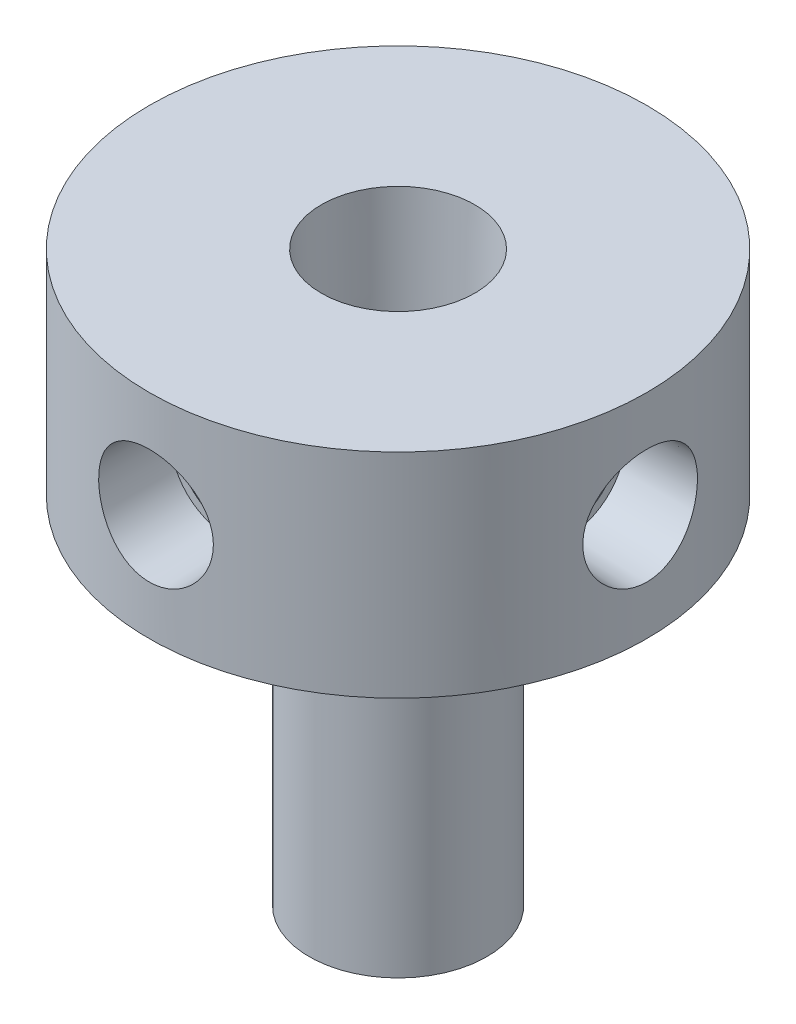
from build123d import *

# Parameters (mm, degrees)
SKETCH1_R                              = 22.225
BOSS_EXTRUDE1_DEPTH                    = 50.8
SKETCH2_OUTSIDE_W                      = 62.614
SKETCH2_OUTSIDE_H                      = 62.614
SKETCH2_OUTSIDE_R                      = 7.9375
CUT_EXTRUDE1_DEPTH                     = 31.75
F_1_8_0_125_DIAMETER_HOLE1_D           = 3.175
F_1_8_START                            = -22.225000076
F_1_8_0_125_DIAMETER_HOLE2_OUTLINE_R   = 1.5875
F_1_8_0_125_DIAMETER_HOLE2_DEPTH       = 31.186397695
F_1_8_START_2                          = -8.961397619
F_1_8_0_125_DIAMETER_HOLE2_2_OUTLINE_R = 1.5875
F_1_8_0_125_DIAMETER_HOLE2_2_DEPTH     = 17.922795238
F_1_8_27_NPSM_TAPPED_HOLE1_D           = 9.0932
F_1_8_27_NPSM_TAPPED_HOLE1_DEPTH       = 6.35
F_1_8_27_NPSM_TAPPED_HOLE1_TIP         = 2.73187289
CUT_EXTRUDE2_START                     = -13.97
SKETCH11_R                             = 4.5466
CUT_EXTRUDE2_DEPTH                     = 6.35
SKETCH12_R                             = 2.54
CUT_EXTRUDE3_DEPTH                     = 1.5875
CUT_EXTRUDE5_START                     = -31.75
SKETCH13_OUTSIDE_W                     = 62.614
SKETCH13_OUTSIDE_H                     = 62.614
SKETCH13_OUTSIDE_R                     = 6.35
CUT_EXTRUDE5_DEPTH                     = 1.5875


# Read off the part's stored shape, not the designer's step: 1/8 (0.125) Diameter Hole2
with BuildPart() as part:
    # Sketch1 → Boss-Extrude1 (new body)
    with BuildSketch(Plane(origin=(0, 0, 0), x_dir=(1, 0, 0), z_dir=(0, 1, 0))):
        with Locations(Location((0, 0, 0), (0, 0, 270))):
            Circle(SKETCH1_R)
    extrude(amount=BOSS_EXTRUDE1_DEPTH)

    # Sketch2 outside → Cut-Extrude1 (cut)
    with BuildSketch(Plane(origin=(0, 0, 0), x_dir=(-1, 0, 0), z_dir=(0, -1, 0))):
        Rectangle(SKETCH2_OUTSIDE_W, SKETCH2_OUTSIDE_H)
        with Locations(Location((0, 0, 0), (0, 0, 90))):
            Circle(SKETCH2_OUTSIDE_R, mode=Mode.SUBTRACT)
    extrude(amount=-CUT_EXTRUDE1_DEPTH, mode=Mode.SUBTRACT)

    # 1/8 (0.125) Diameter Hole1 (through all)
    with Locations(Plane(origin=(0, 50.8, 0), x_dir=(1, 0, 0), z_dir=(0, 1, 0))):
        with Locations((0, 0)):
            Hole(F_1_8_0_125_DIAMETER_HOLE1_D / 2)

    # Sketch6 → 1/4 NPT Tapped Hole1 (revolve, cut)
    with BuildSketch(Plane(origin=(0, 50.8, 0), x_dir=(0, 0, 1), z_dir=(1, 0, 0))):
        Polygon((0, 0), (0, 20.275689079), (5.5626, 16.9333418), (5.5626, 9.906), (6.557984794, 9.906), (6.8545837, 0), align=None)
    revolve(axis=Axis((0, 57.15, 0), (0, -1, 0)), mode=Mode.SUBTRACT)

    # Sketch8 → 1/8 NPT Tapped Hole1 (revolve, cut)
    with BuildSketch(Plane(origin=(22.225, 41.275, 0), x_dir=(0, 0, -1), z_dir=(0, 1, 0))):
        Polygon((0, 0), (0, 14.217468714), (4.2164, 11.684), (4.2164, 6.858), (4.936181096, 6.858), (5.1415188, 0), align=None)
    revolve(axis=Axis((28.575, 41.275, 0), (-1, 0, 0)), mode=Mode.SUBTRACT)

    # Sketch8 at point 2 (carried to point 2, square into its face) → 1/8 NPT Tapped Hole1 at 2 (revolve, cut)
    with BuildSketch(Plane(origin=(0, 41.275, -22.225), x_dir=(-1, 0, 0), z_dir=(0, 1, 0))):
        Polygon((0, 0), (0, 14.217468714), (4.2164, 11.684), (4.2164, 6.858), (4.936181096, 6.858), (5.1415188, 0), align=None)
    revolve(axis=Axis((0, 41.275, -28.575), (0, 0, 1)), mode=Mode.SUBTRACT)

    # Sketch8 at point 3 (carried to point 3, square into its face) → 1/8 NPT Tapped Hole1 at 3 (revolve, cut)
    with BuildSketch(Plane(origin=(0, 41.275, 22.225), x_dir=(1, 0, 0), z_dir=(0, 1, 0))):
        Polygon((0, 0), (0, 14.217468714), (4.2164, 11.684), (4.2164, 6.858), (4.936181096, 6.858), (5.1415188, 0), align=None)
    revolve(axis=Axis((0, 41.275, 28.575), (0, 0, -1)), mode=Mode.SUBTRACT)

    # 1/8 (0.125) Diameter Hole2 outline → 1/8 (0.125) Diameter Hole2 (cut)
    with BuildSketch(Plane.YZ.offset(F_1_8_START)):
        with Locations((41.275, 0)):
            Circle(F_1_8_0_125_DIAMETER_HOLE2_OUTLINE_R)
    extrude(amount=F_1_8_0_125_DIAMETER_HOLE2_DEPTH, mode=Mode.SUBTRACT)

    # 1_8 _0.125_ Diameter Hole2 2 outline → 1_8 _0.125_ Diameter Hole2 2 (cut)
    with BuildSketch(Plane.XY.offset(F_1_8_START_2)):
        with Locations((0, 41.275)):
            Circle(F_1_8_0_125_DIAMETER_HOLE2_2_OUTLINE_R)
    extrude(amount=F_1_8_0_125_DIAMETER_HOLE2_2_DEPTH, mode=Mode.SUBTRACT)

    # 1/8-27 NPSM Tapped Hole1
    with Locations(Plane(origin=(-22.225, 41.275, 0), x_dir=(0, 0, -1), z_dir=(-1, 0, 0))):
        with Locations((0, 0)):
            Hole(F_1_8_27_NPSM_TAPPED_HOLE1_D / 2, depth=F_1_8_27_NPSM_TAPPED_HOLE1_DEPTH)
            with Locations((0, 0, -(F_1_8_27_NPSM_TAPPED_HOLE1_DEPTH + F_1_8_27_NPSM_TAPPED_HOLE1_TIP / 2))):  # 118° drill point
                Cone(0, F_1_8_27_NPSM_TAPPED_HOLE1_D / 2, F_1_8_27_NPSM_TAPPED_HOLE1_TIP, mode=Mode.SUBTRACT)

    # Sketch11 → Cut-Extrude2 (cut)
    with BuildSketch(Plane(origin=(0, 0, 0), x_dir=(0, 0, -1), z_dir=(1, 0, 0)).offset(CUT_EXTRUDE2_START)):
        with Locations(Location((0, 41.275, 0), (0, 0, 180))):
            Circle(SKETCH11_R)
    extrude(amount=-CUT_EXTRUDE2_DEPTH, mode=Mode.SUBTRACT)

    # Sketch12 → Cut-Extrude3 (cut)
    with BuildSketch(Plane.ZY.offset(13.97)):
        with Locations((0, 41.275)):
            Circle(SKETCH12_R)
    extrude(amount=-CUT_EXTRUDE3_DEPTH, mode=Mode.SUBTRACT)

    # Sketch13 outside → Cut-Extrude5 (cut)
    with BuildSketch(Plane.XZ.offset(CUT_EXTRUDE5_START)):
        Rectangle(SKETCH13_OUTSIDE_W, SKETCH13_OUTSIDE_H)
        with Locations(Location((0, 0, 0), (0, 0, 270))):
            Circle(SKETCH13_OUTSIDE_R, mode=Mode.SUBTRACT)
    extrude(amount=CUT_EXTRUDE5_DEPTH, mode=Mode.SUBTRACT)


solid = part.part
